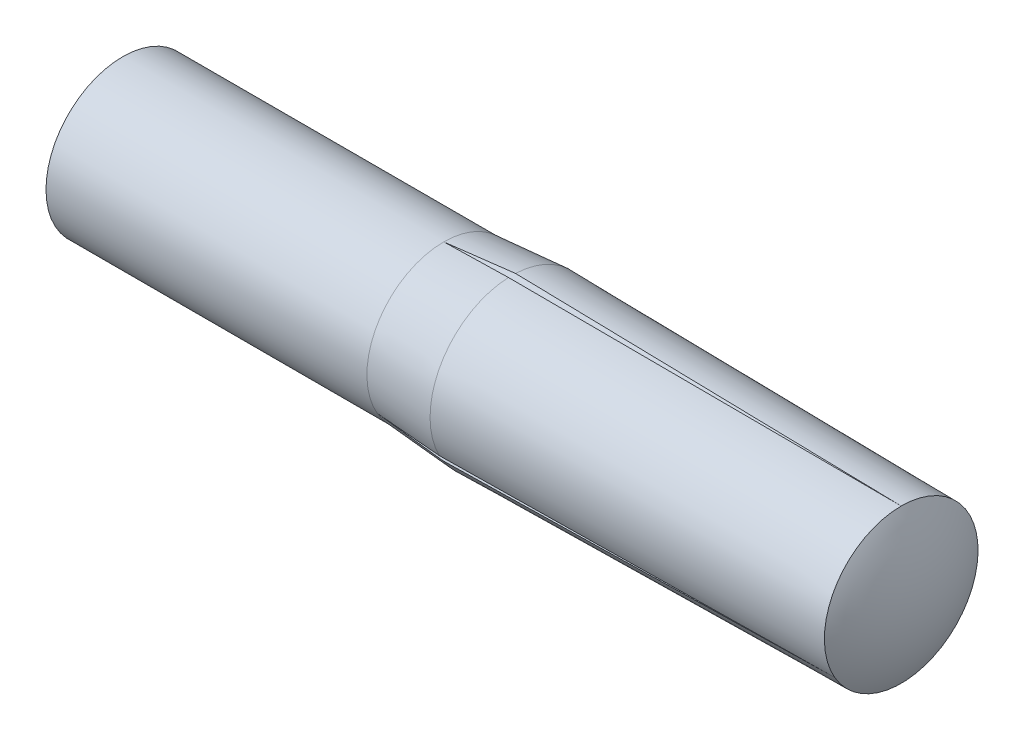
from build123d import *

# Parameters (mm, degrees)
CUT_EXTRUDE2_DEPTH = 9.079603951
CIRPATTERN2_COUNT  = 3


with BuildPart() as part:
    # Sketch1 → Revolve2 (revolve)
    with BuildSketch(Plane.XY):
        with BuildLine():
            Line((0.2, 0.75), (3.333333333, 0.75))
            Line((3.333333333, 0.75), (4, 0.8))
            Line((4, 0.8), (7.8, 0.75))
            ThreePointArc((7.8, 0.75), (7.949141378, 0.388104367), (8, 0))
            Line((8, 0), (0, 0))
            ThreePointArc((0, 0), (0.050858622, 0.388104367), (0.2, 0.75))
        make_face()
    revolve(axis=Axis((0, 0, 0), (1, 0, 0)))

    # Sketch2 → Cut-Extrude2 (cut, through all)
    with BuildSketch(Plane(origin=(0, 0, 0), x_dir=(0, 0, -1), z_dir=(1, 0, 0))):
        Polygon((0, 0.75), (-0.070020754, 0.85), (0.070020754, 0.85), align=None)
    cut_extrude2 = extrude(amount=CUT_EXTRUDE2_DEPTH, mode=Mode.SUBTRACT)

    # CirPattern2: Cut-Extrude2 ×3 about axis
    cirpattern2_axis = Axis((0, 0, 0), (1, 0, 0))
    for i in range(1, CIRPATTERN2_COUNT):
        add(cut_extrude2.rotate(cirpattern2_axis, i * 360 / CIRPATTERN2_COUNT), mode=Mode.SUBTRACT)


solid = part.part
